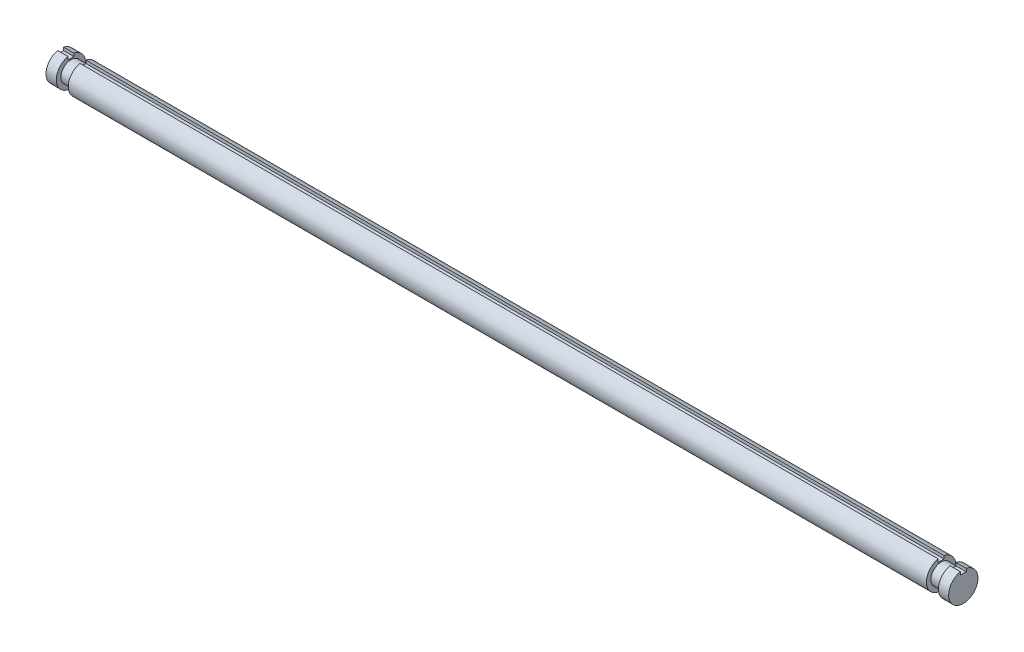
from build123d import *

# Parameters (mm, degrees)
CUT_EXTRUDE2_START = -22.352
SKETCH2_W          = 63.4619
SKETCH2_H          = 12.7
CUT_EXTRUDE2_DEPTH = 1997.456


with BuildPart() as part:
    # Sketch1 → Revolve1 (revolve)
    with BuildSketch(Plane(origin=(0, 0, 0), x_dir=(0, 1, 0), z_dir=(0, 0, 1))):
        Polygon((0, 0), (31.73095, 0), (31.73095, -22.352), (22.0218, -22.352), (22.0218, -48.1584), (31.73095, -48.1584), (31.73095, -1904.7206), (22.0218, -1904.7206), (22.0218, -1930.527), (31.73095, -1930.527), (31.73095, -1952.752), (0, -1952.752), align=None)
    revolve(axis=Axis((-25.4, 0, 0), (1, 0, 0)))

    # Sketch2 → Cut-Extrude2 (cut)
    with BuildSketch(Plane.YZ.offset(CUT_EXTRUDE2_START)):
        with Locations((56.3372, 0)):
            Rectangle(SKETCH2_W, SKETCH2_H)
    extrude(amount=CUT_EXTRUDE2_DEPTH, mode=Mode.SUBTRACT)


solid = part.part
